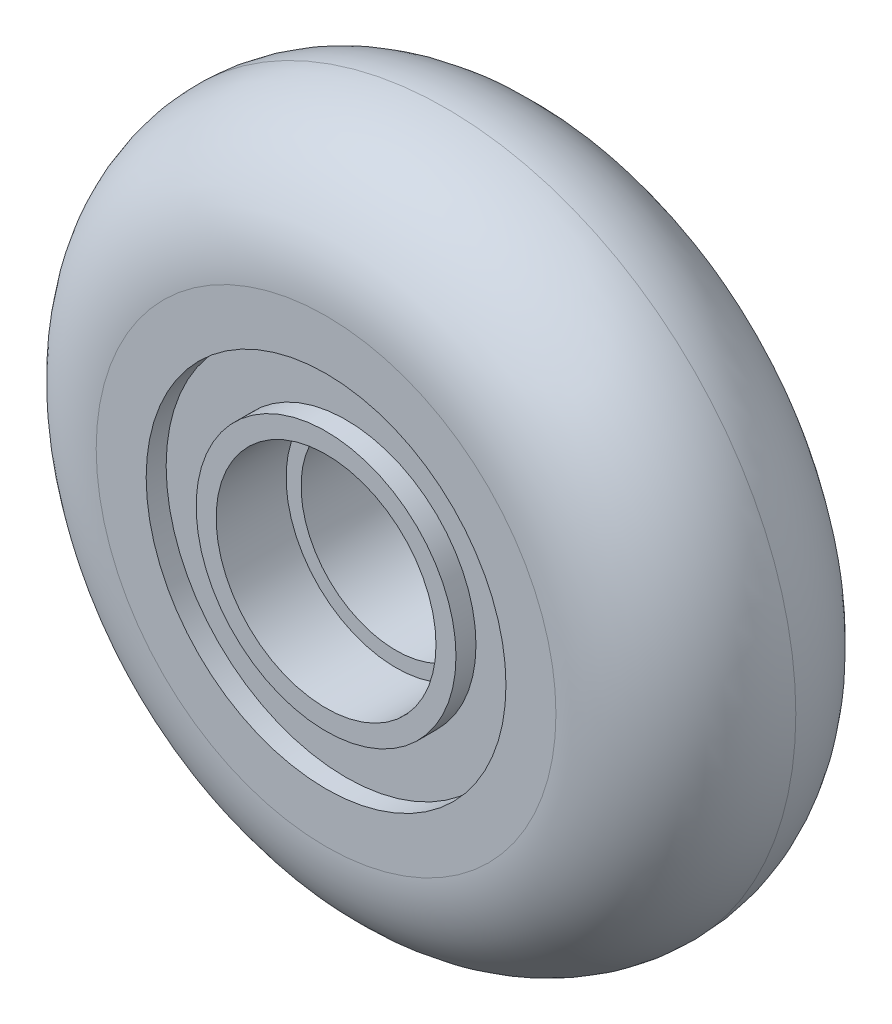
from build123d import *

# Parameters (mm, degrees)
ESQUISSE1_R             = 35
EXTRUSION1_DEPTH        = 24
CONG_1_R                = 12
CONG_2_R                = 12
ESQUISSE2_R             = 11
ENL_V_MAT_EXTRU_1_DEPTH = 7
ENL_V_START             = -7
ESQUISSE3_R             = 11
ENL_V_MAT_EXTRU_2_DEPTH = 7
ESQUISSE5_R             = 9.5
ENL_V_MAT_EXTRU_3_DEPTH = 53.335456499
ESQUISSE8_R             = 18
ESQUISSE8_R_2           = 13
ENL_V_MAT_EXTRU_4_DEPTH = 2
ENL_V_START_2           = -2
ESQUISSE9_R             = 18
ESQUISSE9_R_2           = 13
ENL_V_MAT_EXTRU_5_DEPTH = 2


with BuildPart() as part:
    # Esquisse1 → Extrusion1 (new body)
    with BuildSketch(Plane.XY):
        Circle(ESQUISSE1_R)
    extrude(amount=EXTRUSION1_DEPTH)

    # Congé1
    cong_1_edges = [part.edges().sort_by_distance(p)[0] for p in [
        (-35, 0, 24),
    ]]
    fillet(cong_1_edges, radius=CONG_1_R)

    # Congé2
    cong_2_edges = [part.edges().sort_by_distance(p)[0] for p in [
        (-35, 0, 0),
    ]]
    fillet(cong_2_edges, radius=CONG_2_R - 0.0001)  # a hair under: the kernel refuses the full size

    # Esquisse2 → Enlèv. mat.-Extru.1 (cut)
    with BuildSketch(Plane.XY.offset(24)):
        Circle(ESQUISSE2_R)
    extrude(amount=-ENL_V_MAT_EXTRU_1_DEPTH, mode=Mode.SUBTRACT)

    # Esquisse3 → Enlèv. mat.-Extru.2 (cut)
    with BuildSketch(Plane(origin=(0, 0, 0), x_dir=(-1, 0, 0), z_dir=(0, 0, -1)).offset(ENL_V_START)):
        with Locations(Location((0, 0, 0), (0, 0, 180))):
            Circle(ESQUISSE3_R)
    extrude(amount=ENL_V_MAT_EXTRU_2_DEPTH, mode=Mode.SUBTRACT)

    # Esquisse5 → Enlèv. mat.-Extru.3 (cut, through all)
    with BuildSketch(Plane.XY.offset(17)):
        Circle(ESQUISSE5_R)
    extrude(amount=-ENL_V_MAT_EXTRU_3_DEPTH, mode=Mode.SUBTRACT)

    # Esquisse8 → Enlèv. mat.-Extru.4 (cut)
    with BuildSketch(Plane(origin=(0, 0, 0), x_dir=(-1, 0, 0), z_dir=(0, 0, -1))):
        Circle(ESQUISSE8_R)
        Circle(ESQUISSE8_R_2, mode=Mode.SUBTRACT)
    extrude(amount=-ENL_V_MAT_EXTRU_4_DEPTH, mode=Mode.SUBTRACT)

    # Esquisse9 → Enlèv. mat.-Extru.5 (cut)
    with BuildSketch(Plane.XY.offset(24).offset(ENL_V_START_2)):
        with Locations(Location((0, 0, 0), (0, 0, 180))):
            Circle(ESQUISSE9_R)
        with Locations(Location((0, 0, 0), (0, 0, 180))):
            Circle(ESQUISSE9_R_2, mode=Mode.SUBTRACT)
    extrude(amount=ENL_V_MAT_EXTRU_5_DEPTH, mode=Mode.SUBTRACT)


solid = part.part
